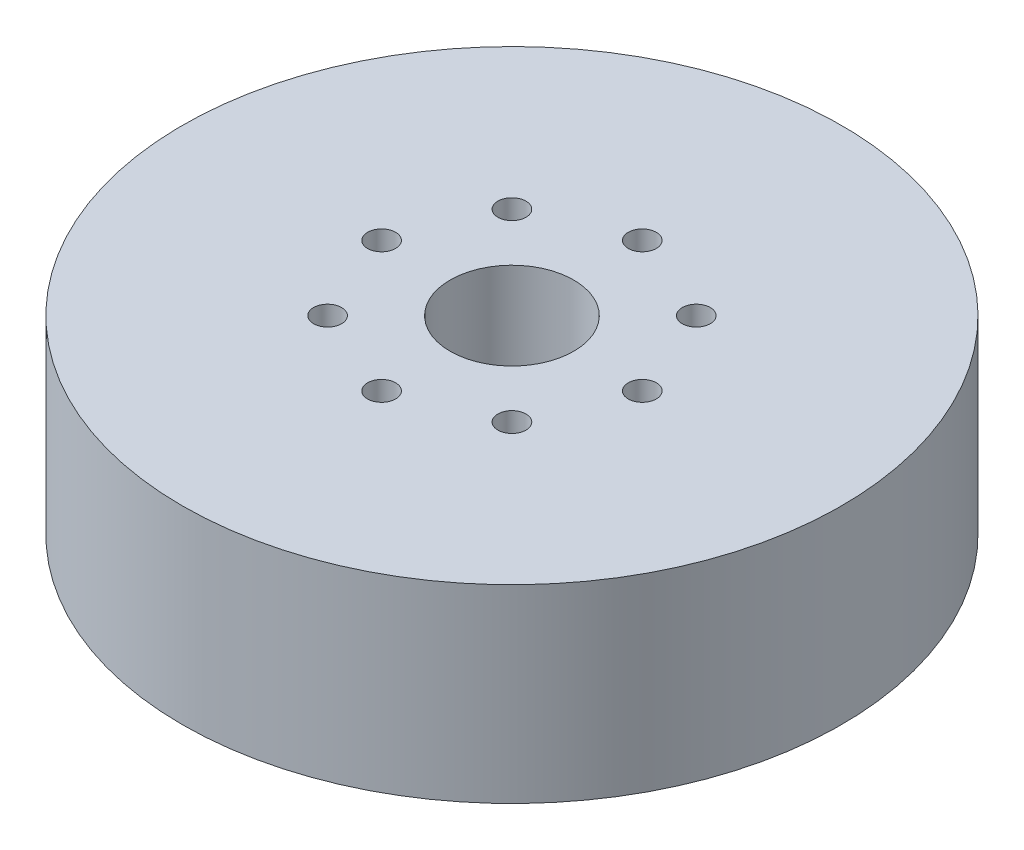
from build123d import *

# Parameters (mm, degrees)
SKETCH1_R           = 40
BOSS_EXTRUDE1_DEPTH = 23
SKETCH2_R           = 7.5
CUT_EXTRUDE1_DEPTH  = 62.065538563
SKETCH3_R           = 1.703907344
CUT_EXTRUDE2_DEPTH  = 16.285937871
CIRPATTERN1_COUNT   = 8


with BuildPart() as part:
    # Sketch1 → Boss-Extrude1 (new body)
    with BuildSketch(Plane(origin=(0, 0, 0), x_dir=(1, 0, 0), z_dir=(0, 1, 0))):
        Circle(SKETCH1_R)
    extrude(amount=BOSS_EXTRUDE1_DEPTH)

    # Sketch2 → Cut-Extrude1 (cut, through all)
    with BuildSketch(Plane(origin=(0, 0, 0), x_dir=(1, 0, 0), z_dir=(0, 1, 0))):
        Circle(SKETCH2_R)
    extrude(amount=CUT_EXTRUDE1_DEPTH, mode=Mode.SUBTRACT)

    # Sketch3 → Cut-Extrude2 (cut)
    with BuildSketch(Plane(origin=(0, 23, 0), x_dir=(1, 0, 0), z_dir=(0, 1, 0))):
        with Locations((-15.819677752, 0)):
            Circle(SKETCH3_R)
    cut_extrude2 = extrude(amount=-CUT_EXTRUDE2_DEPTH, mode=Mode.SUBTRACT)

    # CirPattern1: Cut-Extrude2 ×8 about axis
    cirpattern1_axis = Axis((0, 0, 0), (0, 1, 0))
    for i in range(1, CIRPATTERN1_COUNT):
        add(cut_extrude2.rotate(cirpattern1_axis, i * 360 / CIRPATTERN1_COUNT), mode=Mode.SUBTRACT)


solid = part.part
